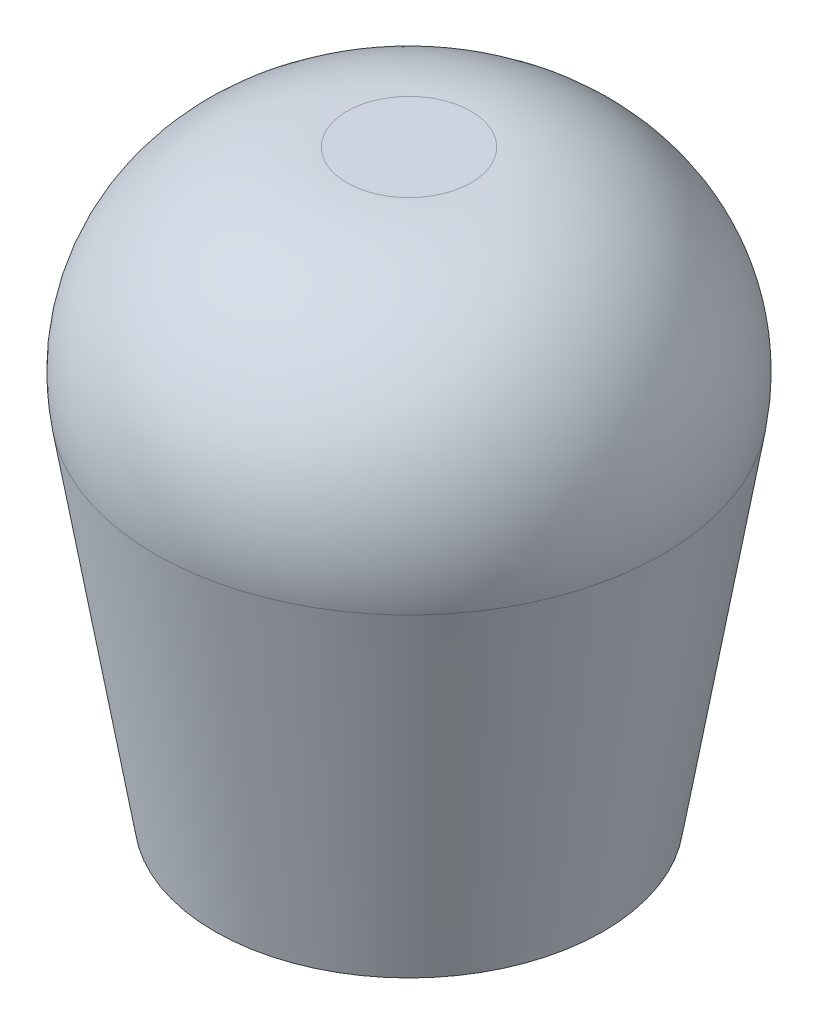
from build123d import *

# Parameters (mm, degrees)
SKETCH3_R          = 2.5
CUT_EXTRUDE1_DEPTH = 1
FILLET1_R          = 5
SCALE1_SCALE       = 3


# Read off the part's stored shape, not the designer's step: Boundary1
with BuildPart() as part:
    # Boundary1 outline → Boundary1 (revolve)
    with BuildSketch(Plane.XY):
        Polygon((0, 0), (5, 0), (7.5, 15), (0, 15), align=None)
    revolve(axis=Axis((0, 0, 0), (0, 1, 0)))

    # Sketch3 → Cut-Extrude1 (cut)
    with BuildSketch(Plane.XZ):
        with Locations(Location((0, 0, 0), (0, 0, 270))):
            Circle(SKETCH3_R)
    extrude(amount=-CUT_EXTRUDE1_DEPTH, mode=Mode.SUBTRACT)

    # Fillet1
    fillet1_edges = [part.edges().sort_by_distance(p)[0] for p in [
        (-7.5, 15, 0),
    ]]
    fillet(fillet1_edges, radius=FILLET1_R)


with BuildPart() as part_1:
    # Scale1: scaled about (0, 0, 0)
    add(part.part.scale(SCALE1_SCALE))


solid = part_1.part
